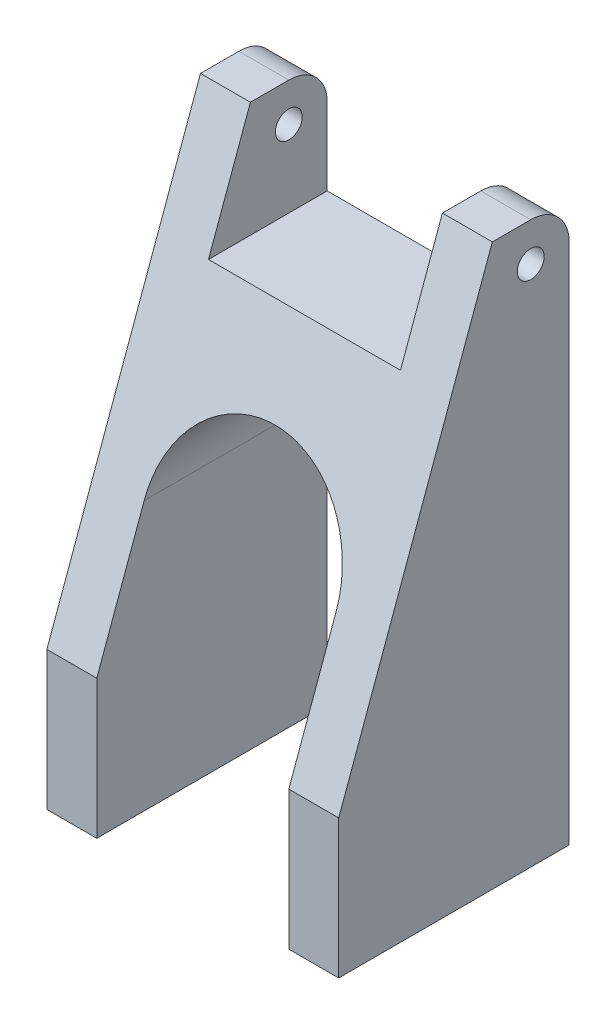
from build123d import *

# Parameters (mm, degrees)
BOSS_EXTRUDE1_DEPTH = 30
SKETCH2_R           = 2
CUT_EXTRUDE1_DEPTH  = 15
FILLET1_R           = 5
CHAMFER1_SIZE       = 20
CHAMFER1_SIZE_2     = 54.949548389
SKETCH3_W           = 25
SKETCH3_H           = 39.596952294
CUT_EXTRUDE2_DEPTH  = 15
SKETCH4_R           = 1.75
CUT_EXTRUDE3_DEPTH  = 62.546730214


with BuildPart() as part:
    # Sketch1 → Boss-Extrude1 (new body)
    with BuildSketch(Plane.XY):
        with BuildLine():
            Line((-12.5, 0), (-12.5, -35))
            Line((-12.5, -35), (-19, -35))
            Line((-19, -35), (-19, 38))
            Line((-19, 38), (19, 38))
            Line((19, 38), (19, -35))
            Line((19, -35), (12.5, -35))
            Line((12.5, -35), (12.5, 0))
            ThreePointArc((12.5, 0), (0, 12.5), (-12.5, 0))
        make_face()
    extrude(amount=BOSS_EXTRUDE1_DEPTH)

    # Sketch2 → Cut-Extrude1 (cut)
    with BuildSketch(Plane.XZ.offset(35)):
        with Locations(Location((-15, 5, 0), (0, 0, 270))):
            Circle(SKETCH2_R)
        with Locations(Location((15, 5, 0), (0, 0, 270))):
            Circle(SKETCH2_R)
        with Locations(Location((-15, 15, 0), (0, 0, 270))):
            Circle(SKETCH2_R)
        with Locations(Location((15, 15, 0), (0, 0, 270))):
            Circle(SKETCH2_R)
        with Locations(Location((-15, 25, 0), (0, 0, 270))):
            Circle(SKETCH2_R)
        with Locations(Location((15, 25, 0), (0, 0, 270))):
            Circle(SKETCH2_R)
    extrude(amount=-CUT_EXTRUDE1_DEPTH, mode=Mode.SUBTRACT)

    # Fillet1
    fillet1_edges = [part.edges().sort_by_distance(p)[0] for p in [
        (0, 38, 0),
    ]]
    fillet(fillet1_edges, radius=FILLET1_R)

    # Chamfer1
    # the kernel refuses this chamfer: 54.949548389, 20 mm, written as the material it takes off along each edge
    with BuildSketch(Plane(origin=(-161.549828987, 38, 30), x_dir=(0, 0.09904090225205052, -0.9950833631817486), z_dir=(1, 0, 0))) as chamfer1_piece_1:
        Polygon((CHAMFER1_SIZE * 0.995083363182, -CHAMFER1_SIZE * 0.0990409022521), (-CHAMFER1_SIZE_2 * 0.0990409022522, -CHAMFER1_SIZE_2 * 0.995083363183), (0, 0), align=None)
    extrude(amount=323.099657974, mode=Mode.SUBTRACT)

    # Sketch3 → Cut-Extrude2 (cut)
    with BuildSketch(Plane(origin=(0, 38, 0), x_dir=(1, 0, 0), z_dir=(0, 1, 0))):
        Rectangle(SKETCH3_W, SKETCH3_H)
    extrude(amount=-CUT_EXTRUDE2_DEPTH, mode=Mode.SUBTRACT)

    # Sketch4 → Cut-Extrude3 (cut, through all)
    with BuildSketch(Plane.ZY.offset(19)):
        with Locations((5, 33)):
            Circle(SKETCH4_R)
    extrude(amount=-CUT_EXTRUDE3_DEPTH, mode=Mode.SUBTRACT)


solid = part.part
